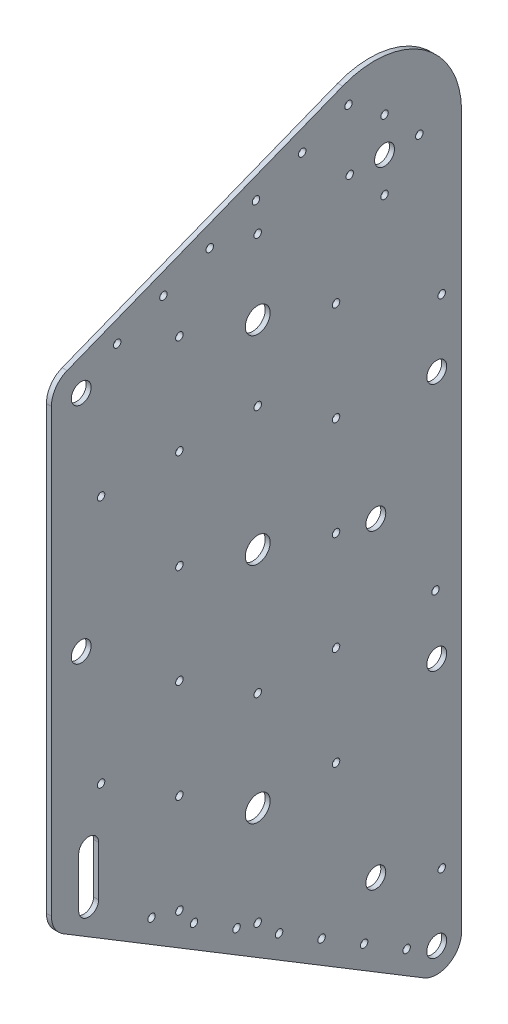
from build123d import *

# Parameters (mm, degrees)
BOSS_EXTRUDE1_DEPTH = 2
FILLET1_R           = 10
SKETCH3_R           = 1.5
SKETCH3_R_2         = 4
SKETCH3_R_3         = 5
CUT_EXTRUDE1_DEPTH  = 2
FILLET2_R           = 35


with BuildPart() as part:
    # Sketch2 → Boss-Extrude1 (new body)
    with BuildSketch(Plane(origin=(0, 0, 0), x_dir=(0, 1, 0), z_dir=(-1, 0, 0))):
        Polygon((0, 0), (65, 165), (-290, 165), (-190, 0), align=None)
    extrude(amount=BOSS_EXTRUDE1_DEPTH)

    # Fillet1
    fillet1_edges = [part.edges().sort_by_distance(p)[0] for p in [
        (-1, -190, 0),
        (-1, -290, -165),
        (-1, 0, 0),
    ]]
    fillet(fillet1_edges, radius=FILLET1_R)

    # Sketch3 → Cut-Extrude1 (cut)
    with BuildSketch(Plane(origin=(-2, 0, 0), x_dir=(0, 1, 0), z_dir=(-1, 0, 0))):
        with Locations((-228.170289346, 83)):
            Circle(SKETCH3_R)
        with Locations((-246.246193102, 157)):
            Circle(SKETCH3_R)
        with Locations((-46.246193102, 157)):
            Circle(SKETCH3_R)
        with Locations((11.829710654, 83)):
            Circle(SKETCH3_R)
        with Locations((13.829710654, 148)):
            Circle(SKETCH3_R)
        with Locations((27.829710654, 134)):
            Circle(SKETCH3_R)
        with Locations((13.829710654, 120)):
            Circle(SKETCH3_R)
        with Locations((-0.170289346, 134)):
            Circle(SKETCH3_R)
        with Locations((-272.246193102, 155)):
            Circle(SKETCH3_R_2)
        with Locations((-172.246193102, 155)):
            Circle(SKETCH3_R_2)
        with Locations((13.829710654, 134)):
            Circle(SKETCH3_R_2)
        with Locations((-236.170289346, 130.5)):
            Circle(SKETCH3_R_2)
        with Locations((-111.170289346, 130.5)):
            Circle(SKETCH3_R_2)
        with Locations((-18.170289346, 83)):
            Circle(SKETCH3_R_3)
        with Locations((-188.170289346, 83)):
            Circle(SKETCH3_R_3)
        with Locations((-98.170289346, 83)):
            Circle(SKETCH3_R_3)
        with Locations((-205.049987171, 40.267503937)):
            Circle(SKETCH3_R)
        with Locations((-208.170289346, 51.5)):
            Circle(SKETCH3_R)
        with Locations((-225.782055815, 74.475417199)):
            Circle(SKETCH3_R)
        with Locations((-236.148090136, 91.57937383)):
            Circle(SKETCH3_R)
        with Locations((-246.514124458, 108.683330462)):
            Circle(SKETCH3_R)
        with Locations((-256.88015878, 125.787287093)):
            Circle(SKETCH3_R)
        with Locations((-267.246193102, 142.891243724)):
            Circle(SKETCH3_R)
        with Locations((1.829710654, 26.47129363)):
            Circle(SKETCH3_R)
        with Locations((9.160201021, 45.079461487)):
            Circle(SKETCH3_R)
        with Locations((16.490691389, 63.687629343)):
            Circle(SKETCH3_R)
        with Locations((23.821181757, 82.295797199)):
            Circle(SKETCH3_R)
        with Locations((31.151672124, 100.903965056)):
            Circle(SKETCH3_R)
        with Locations((38.482162492, 119.512132912)):
            Circle(SKETCH3_R)
        with Locations((-72.246193102, 155)):
            Circle(SKETCH3_R_2)
        with Locations((-148.170289346, 154.5)):
            Circle(SKETCH3_R)
        with Locations((-188.170289346, 114.5)):
            Circle(SKETCH3_R)
        with Locations((-148.170289346, 114.5)):
            Circle(SKETCH3_R)
        with Locations((-108.170289346, 114.5)):
            Circle(SKETCH3_R)
        with Locations((-68.170289346, 114.5)):
            Circle(SKETCH3_R)
        with Locations((-28.170289346, 114.5)):
            Circle(SKETCH3_R)
        with Locations((-148.170289346, 83)):
            Circle(SKETCH3_R)
        with Locations((-215.416021493, 57.371460568)):
            Circle(SKETCH3_R)
        with Locations((-168.170289346, 51.5)):
            Circle(SKETCH3_R)
        with Locations((-8.170289346, 51.5)):
            Circle(SKETCH3_R)
        with Locations((-128.170289346, 51.5)):
            Circle(SKETCH3_R)
        with Locations((-88.170289346, 51.5)):
            Circle(SKETCH3_R)
        with Locations((-48.170289346, 83)):
            Circle(SKETCH3_R)
        with Locations((-48.170289346, 51.5)):
            Circle(SKETCH3_R)
        with Locations((-8.170289346, 12)):
            Circle(SKETCH3_R_2)
        with Locations((-148.170289346, 20)):
            Circle(SKETCH3_R)
        with Locations((-98.170289346, 12)):
            Circle(SKETCH3_R_2)
        with Locations((-48.170289346, 20)):
            Circle(SKETCH3_R)
        with BuildLine():
            Line((-188.170289346, 11), (-168.170289346, 11))
            ThreePointArc((-168.170289346, 11), (-164.170289346, 15), (-168.170289346, 19))
            Line((-168.170289346, 19), (-188.170289346, 19))
            ThreePointArc((-188.170289346, 19), (-192.170289346, 15), (-188.170289346, 11))
        make_face()
    extrude(amount=-CUT_EXTRUDE1_DEPTH, mode=Mode.SUBTRACT)

    # Fillet2
    fillet2_edges = [part.edges().sort_by_distance(p)[0] for p in [
        (-1, 65, -165),
    ]]
    fillet(fillet2_edges, radius=FILLET2_R)


solid = part.part
